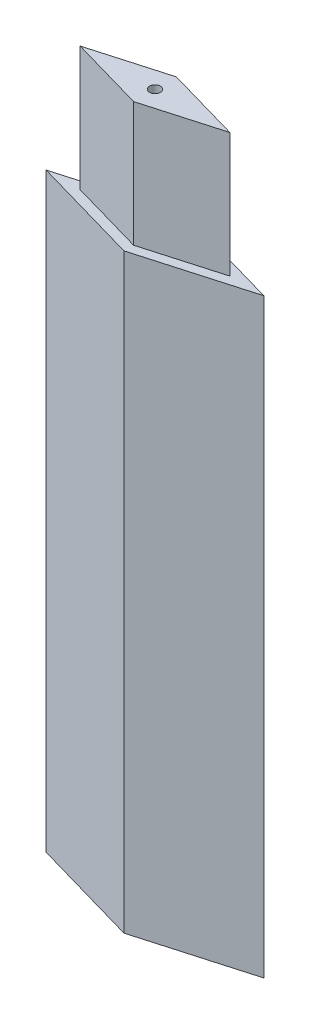
from build123d import *

# Parameters (mm, degrees)
SWEEP_1_DEPTH            = 610
CUT_EXTRUDE_2_DEPTH      = 12
SKETCH_21_R              = 1.75
CUT_EXTRUDE_3_DEPTH      = 600
CUT_EXTRUDE_4_DEPTH      = 691.959477934
CUT_EXTRUDE_4_DEPTH_BACK = 691.959477934
SKETCH_26_OUTSIDE_W      = 208.38
SKETCH_26_OUTSIDE_H      = 816.38
SKETCH_26_OUTSIDE_W_2    = 70
SKETCH_26_OUTSIDE_H_2    = 230
CUT_EXTRUDE_5_DEPTH      = 41
SKETCH_28_OUTSIDE_W      = 120.25
SKETCH_28_OUTSIDE_H      = 70.25
CUT_EXTRUDE_7_DEPTH      = 40


# Read off the part's stored shape, not the designer's step: 扫描1
with BuildPart() as part:
    # 扫描1 outline → 扫描1 (new body)
    with BuildSketch(Plane(origin=(0, 0, 0), x_dir=(1, 0, 0), z_dir=(0, 1, 0))):
        Polygon((-35, 0), (35, 0), (0, 10), align=None)
    sweep_1 = extrude(amount=SWEEP_1_DEPTH)

    # 草图1 → 放样1 section 0
    with BuildSketch(Plane.XY, mode=Mode.PRIVATE) as loft_1_s0:
        with BuildLine():
            Line((-35, 610), (0, 690))
            Line((0, 690), (35, 610))
            Line((35, 610), (-35, 610))
        make_face()
    loft_1 = loft([Vertex(0, 610, -10), loft_1_s0.sketch])

    # 镜向1: 扫描1, 放样1 across plane
    add(sweep_1.mirror(Plane.XY))
    add(loft_1.mirror(Plane.XY))

    # 草图19 → 切除-拉伸2 (cut)
    with BuildSketch(Plane.XZ):
        Polygon((0, -10), (35, 0), (0, 10), (-35, 0), align=None)
    extrude(amount=-CUT_EXTRUDE_2_DEPTH, mode=Mode.SUBTRACT)

    # 草图21 → 切除-拉伸3 (cut)
    with BuildSketch(Plane.XZ.offset(-12)):
        with Locations(Location((0, 0, 0), (0, 0, 270))):
            Circle(SKETCH_21_R)
    extrude(amount=-CUT_EXTRUDE_3_DEPTH, mode=Mode.SUBTRACT)

    # 草图26 outside → 切除-拉伸4 (cut, two sides: drawn at the far end of the back side and taken through both)
    with BuildSketch(Plane.XY.offset(-CUT_EXTRUDE_4_DEPTH_BACK)):
        with Locations((0, 351)):
            Rectangle(SKETCH_26_OUTSIDE_W, SKETCH_26_OUTSIDE_H)
        with Locations((0, 127)):
            Rectangle(SKETCH_26_OUTSIDE_W_2, SKETCH_26_OUTSIDE_H_2, mode=Mode.SUBTRACT)
    extrude(amount=CUT_EXTRUDE_4_DEPTH + CUT_EXTRUDE_4_DEPTH_BACK, mode=Mode.SUBTRACT)

    # 草图27 → 切除-拉伸5 (cut)
    with BuildSketch(Plane.XZ.offset(-12)):
        Polygon((-24.807846155, 0), (0, -7.087956044), (24.807846155, 0), (0, 7.087956044), align=None)
    extrude(amount=-CUT_EXTRUDE_5_DEPTH, mode=Mode.SUBTRACT)

    # 草图28 outside → 切除-拉伸7 (cut)
    with BuildSketch(Plane(origin=(0, 242, 0), x_dir=(1, 0, 0), z_dir=(0, 1, 0))):
        Rectangle(SKETCH_28_OUTSIDE_W, SKETCH_28_OUTSIDE_H)
        Polygon((0, 6.879952905), (-24.079835166, 0), (0, -6.879952905), (24.079835166, 0), align=None, mode=Mode.SUBTRACT)
    extrude(amount=-CUT_EXTRUDE_7_DEPTH, mode=Mode.SUBTRACT)


solid = part.part
